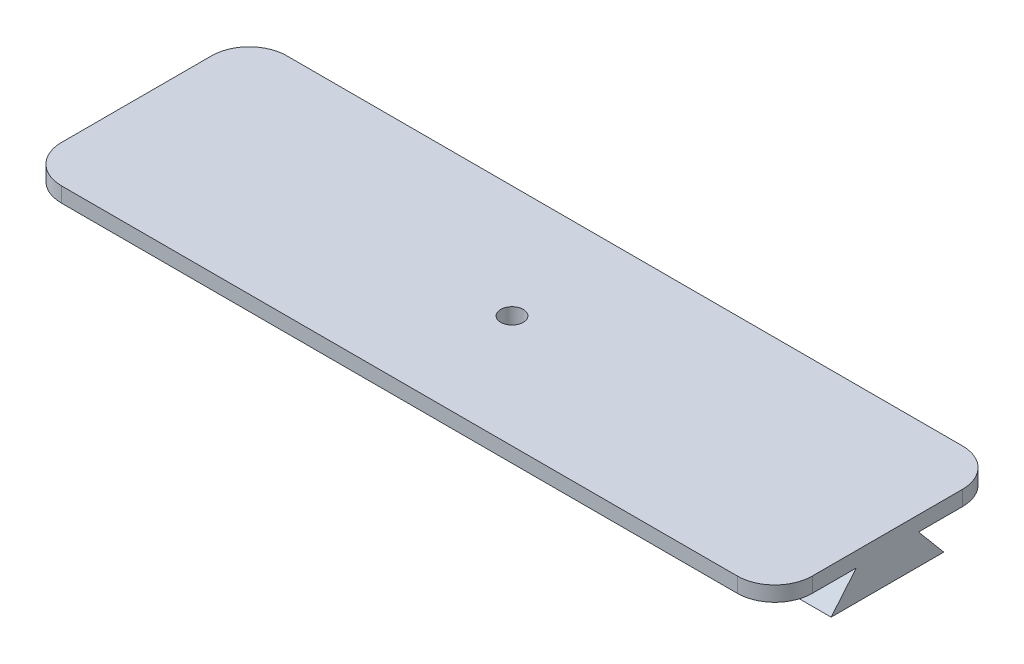
from build123d import *

# Parameters (mm, degrees)
SKETCH4_W           = 100
SKETCH4_H           = 30
BOSS_EXTRUDE2_DEPTH = 6
CUT_EXTRUDE1_DEPTH  = 105.575331699
SKETCH7_R           = 1.5
CUT_EXTRUDE2_DEPTH  = 105.575331699
FILLET2_R           = 5
FILLET3_R           = 5


with BuildPart() as part:
    # Sketch4 → Boss-Extrude2 (new body)
    with BuildSketch(Plane(origin=(0, 0, 0), x_dir=(1, 0, 0), z_dir=(0, 1, 0))):
        with Locations((50, -15)):
            Rectangle(SKETCH4_W, SKETCH4_H)
    extrude(amount=BOSS_EXTRUDE2_DEPTH)

    # Sketch6 → Cut-Extrude1 (cut, through all)
    with BuildSketch(Plane(origin=(100, 0, 0), x_dir=(0, 0, -1), z_dir=(1, 0, 0))):
        Polygon((-7.5, 0), (0, 0), (0, 4), (-10.856398525, 4), align=None)
        Polygon((-22.5, 0), (-30, 0), (-30, 4), (-19.143601475, 4), align=None)
    extrude(amount=-CUT_EXTRUDE1_DEPTH, mode=Mode.SUBTRACT)

    # Sketch7 → Cut-Extrude2 (cut, through all)
    with BuildSketch(Plane(origin=(0, 6, 0), x_dir=(1, 0, 0), z_dir=(0, 1, 0))):
        with Locations((50, -15)):
            Circle(SKETCH7_R)
    extrude(amount=-CUT_EXTRUDE2_DEPTH, mode=Mode.SUBTRACT)

    # Fillet2
    fillet2_edges = [part.edges().sort_by_distance(p)[0] for p in [
        (0, 5, 0),
    ]]
    fillet(fillet2_edges, radius=FILLET2_R)

    # Fillet3
    fillet3_edges = [part.edges().sort_by_distance(p)[0] for p in [
        (100, 5, 0),
        (100, 5, 30),
        (0, 5, 30),
    ]]
    fillet(fillet3_edges, radius=FILLET3_R)


solid = part.part
